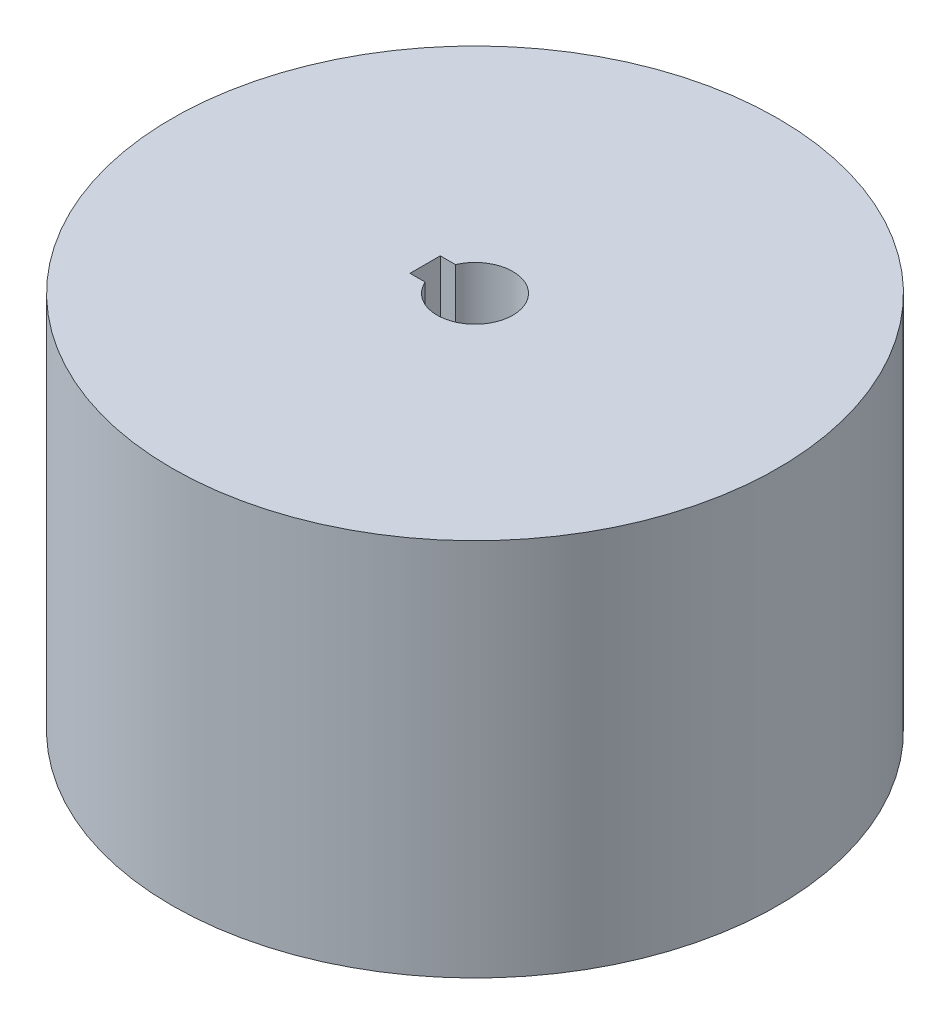
from build123d import *

# Parameters (mm, degrees)
SKETCH_1_R          = 40
SKETCH_1_R_2        = 5
EXTRUDE_1_DEPTH     = 50
SKETCH_2_W          = 2
SKETCH_2_H          = 4
CUT_EXTRUDE_1_DEPTH = 50


with BuildPart() as part:
    # 草图1 → 凸台-拉伸1 (new body)
    with BuildSketch(Plane(origin=(0, 0, 0), x_dir=(1, 0, 0), z_dir=(0, 1, 0))):
        Circle(SKETCH_1_R)
        Circle(SKETCH_1_R_2, mode=Mode.SUBTRACT)
    extrude(amount=EXTRUDE_1_DEPTH)

    # 草图2 → 切除-拉伸1 (cut)
    with BuildSketch(Plane(origin=(0, 50, 0), x_dir=(1, 0, 0), z_dir=(0, 1, 0))):
        with Locations((-5.582575695, 0)):
            Rectangle(SKETCH_2_W, SKETCH_2_H)
    extrude(amount=-CUT_EXTRUDE_1_DEPTH, mode=Mode.SUBTRACT)


solid = part.part
